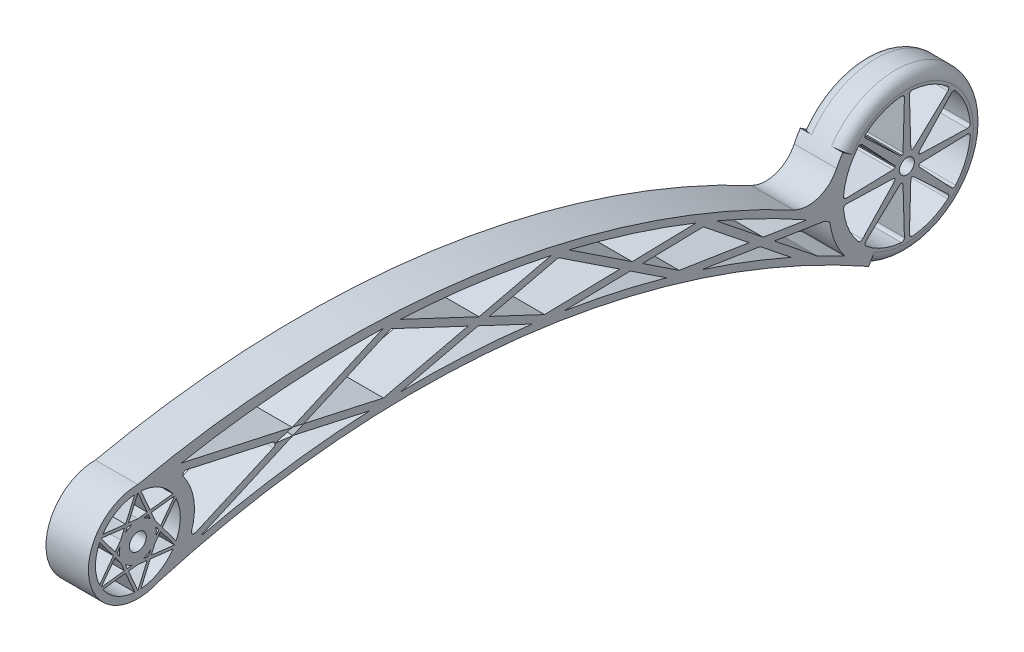
from build123d import *

# Parameters (mm, degrees)
SZKIC1_R                    = 3.0000000000000013
DODANIE_WYCI_GNI_CIE1_DEPTH = 15
WYTNIJ_WYCI_GNI_CIE1_DEPTH  = 303.97760354165104
WYCI_CIE_OBR_T1_ANGLE       = 265.00000000000114
SZKIC4_R                    = 2.6413389418962936
WYTNIJ_WYCI_GNI_CIE2_DEPTH  = 303.97760364050646
ZAOKR_GLENIE2_R             = 1
ZAOKR_GLENIE3_R             = 1


with BuildPart() as part:
    # Szkic1 → Dodanie-wyciągnięcie1 (new body)
    with BuildSketch(Plane(origin=(0, 0, 0), x_dir=(0, 0, -1), z_dir=(1, 0, 0))):
        with BuildLine():
            ThreePointArc((247.14386905317215, 8.669867048888815), (240.61406501931535, 2.878072518954692), (231.9153380807969, 3.595968226311193))
            ThreePointArc((231.91533808079674, 3.595968226310845), (118.77075205195764, 40.0073705160612), (-1.1369e-13, 35.42522894734333))
            ThreePointArc((-4.263e-14, 35.42522894734323), (-17.11785435479439, 14.288051155696689), (7.115506251416886, 1.9371217802628404))
            ThreePointArc((7.115506251417315, 1.9371217802620322), (135.74126507971314, 12.768875604402524), (258.5290498333885, -27.044095150701935))
            ThreePointArc((258.5290498333885, -27.04409515070196), (298.2105787910556, 5.277608418992131), (247.14386905317215, 8.66986704888883))
        make_face()
        with BuildLine():
            Line((86.71196287585684, 39.85172014852097), (54.59601640433131, 25.63196779323211))
            Line((54.59601640433131, 25.63196779323211), (15.371259061907589, 34.30375562276811))
            ThreePointArc((15.371259061907566, 34.303755622767994), (50.88983633712013, 39.02939222675377), (86.71196287585684, 39.85172014852026))
        make_face(mode=Mode.SUBTRACT)
        with BuildLine():
            Line((120.66797341458721, 26.474058591359295), (92.81176762409336, 39.601392917780196))
            ThreePointArc((92.81176762409333, 39.601392917779435), (119.64227628793515, 37.141826382467116), (146.18032427133483, 32.48804599090431))
            Line((146.18032427133505, 32.488045990905256), (120.66797341458721, 26.474058591359295))
        make_face(mode=Mode.SUBTRACT)
        with BuildLine():
            Line((174.84991399733929, 16.273435518201048), (152.4856105962059, 31.04790711767739))
            ThreePointArc((152.48561059620565, 31.047907117676345), (175.25117753037594, 24.736599669939665), (197.5033063836007, 16.802722872715833))
            Line((197.5033063836011, 16.80272287271687), (174.84991399733929, 16.27343551820105))
        make_face(mode=Mode.SUBTRACT)
        with BuildLine():
            Line((221.16225750591792, 0.6095847652137945), (204.59999742397423, 13.883762677302833))
            ThreePointArc((204.59999742397383, 13.883762677301888), (220.82030475857567, 6.4620426304150556), (236.61307264849492, -1.8306517965149283))
            Line((236.61307264849543, -1.8306517965140139), (221.16225750591792, 0.6095847652137937))
        make_face(mode=Mode.SUBTRACT)
        with BuildLine():
            Line((225.09519841335046, -2.5425549225277746), (242.68994389251247, -5.321394797080412))
            ThreePointArc((242.68994389251213, -5.321394797081041), (243.70994318234705, -5.924383596068367), (244.72775709192354, -6.531053925358094))
            ThreePointArc((244.72775709192354, -6.531053925358092), (246.52918688549187, -13.418645500219824), (250.03832796582145, -19.612997434167806))
            ThreePointArc((250.0383279658215, -19.612997434167767), (245.23804821382785, -17.17093269826796), (240.39847516681735, -14.807693693347915))
            Line((240.39847516681735, -14.807693693347897), (225.09519841335046, -2.5425549225277746))
        make_face(mode=Mode.SUBTRACT)
        with BuildLine():
            Line((21.948305518804606, 8.442680568326235), (54.857709427131326, 23.013746507531437))
            Line((54.857709427131326, 23.013746507531433), (81.99464077533202, 17.014328615868333))
            ThreePointArc((81.99464077533202, 17.01432861586835), (51.77371634755495, 14.113835746266773), (21.948305518804602, 8.442680568326239))
        make_face(mode=Mode.SUBTRACT)
        with BuildLine():
            Line((92.96645720572906, 17.375501728865885), (120.39190957994006, 23.84046161952725))
            Line((120.39190957994006, 23.84046161952725), (139.5065287687862, 14.832630527906328))
            ThreePointArc((139.50652876878618, 14.832630527906247), (116.2815352131982, 16.92843679169067), (92.96645720572909, 17.375501728865856))
        make_face(mode=Mode.SUBTRACT)
        with BuildLine():
            Line((150.7937254579246, 13.21069011139366), (174.1253511988679, 13.755824114037251))
            Line((174.1253511988679, 13.755824114037251), (186.99309654488957, 5.255038967541919))
            ThreePointArc((186.99309654488957, 5.25503896754185), (169.00541672809712, 9.742506904499237), (150.7937254579246, 13.21069011139366))
        make_face(mode=Mode.SUBTRACT)
        with BuildLine():
            Line((199.43547561853376, 1.5100334457813434), (220.11666851402651, -1.7562669130035622))
            Line((220.11666851402651, -1.756266913003562), (231.03905749577325, -10.510249391929378))
            ThreePointArc((231.03905749577322, -10.510249391929449), (215.39163289755328, -4.09424986276332), (199.4354756185338, 1.510033445781346))
        make_face(mode=Mode.SUBTRACT)
        with BuildLine():
            Line((14.20879918361564, 32.00038527896806), (50.73912779284115, 23.924280275258774))
            Line((50.73912779284115, 23.924280275258774), (18.132963053328133, 9.487477415884612))
            ThreePointArc((18.13296305332884, 9.487477415884284), (19.702922404067348, 21.3595918779787), (14.20879918361539, 32.000385278967805))
        make_face(mode=Mode.SUBTRACT)
        Polygon((86.8479757216951, 18.501722324906066), (58.71459803862148, 24.72143402550476), (89.55066806325941, 38.374504463564634), (116.75883122700434, 25.552562489680405), align=None, mode=Mode.SUBTRACT)
        Polygon((178.505925039154, 13.858174450783848), (200.0076292842972, 14.360553077500999), (216.1837276065938, 1.3958727747381339), (191.4594501274222, 5.300720856229939), align=None, mode=Mode.SUBTRACT)
        Polygon((143.8506317788958, 15.549149821934162), (124.30105176752294, 24.761957721206137), (148.74353553806114, 30.523746990843186), (170.46934015705276, 16.17108518145446), align=None, mode=Mode.SUBTRACT)
        with Locations((0, 17.925228947343225)):
            Circle(SZKIC1_R, mode=Mode.SUBTRACT)
    extrude(amount=DODANIE_WYCI_GNI_CIE1_DEPTH)

    # Szkic2 → Wytnij-wyciągnięcie1 (cut, through all)
    with BuildSketch(Plane(origin=(15, 0, 0), x_dir=(0, 0, -1), z_dir=(1, 0, 0))):
        Polygon((-4.749370526585766, 24.47363901774454), (-6.067932211414769, 21.428551243027943), (-8.04577473865806, 18.764099440151195), (-12.990381056766234, 25.425228947343374), align=None)
        with BuildLine():
            Line((-8.6684745877329, 17.92522894734628), (-13.508653760358897, 24.44567935990994))
            ThreePointArc((-13.508653760358897, 24.44567935990994), (-15, 17.925228947345317), (-13.508653760360717, 11.40477853478028))
            Line((-13.508653760360717, 11.40477853478028), (-8.6684745877329, 17.92522894734628))
        make_face()
        with BuildLine():
            Line((-6.355965996783881, 19.362785362535288), (-7.42307488958084, 17.925228947343307))
            Line((-7.42307488958084, 17.925228947343307), (-6.355965996783897, 16.487672532151286))
            ThreePointArc((-6.355965996783898, 16.487672532151286), (-6.516507668923027, 17.92522894734329), (-6.35596599678387, 19.362785362535284))
        make_face()
        with BuildLine():
            Line((-3.711537444790369, 24.353800375914847), (-4.422943373321874, 22.710878758551807))
            ThreePointArc((-4.422943373321875, 22.710878758551807), (-3.258253834461477, 23.568690132586703), (-1.9330226234618175, 24.148435173744325))
            Line((-1.9330226234618204, 24.148435173744335), (-3.711537444790369, 24.353800375914847))
        make_face()
        with BuildLine():
            Line((3.711537444790358, 24.353800375914872), (1.9330226234613614, 24.148435173744467))
            ThreePointArc((1.9330226234613608, 24.148435173744467), (3.2582538344613576, 23.56869013258677), (4.422943373322022, 22.710878758551672))
            Line((4.422943373322023, 22.710878758551672), (3.711537444790358, 24.353800375914872))
        make_face()
        with BuildLine():
            Line((7.4230748895808, 17.925228947343463), (6.355965996783689, 19.36278536253609))
            ThreePointArc((6.355965996783688, 19.36278536253609), (6.476247885951691, 18.648475460531408), (6.516507668923027, 17.925228947343225))
            ThreePointArc((6.516507668923027, 17.925228947343225), (6.476247885951745, 17.201982434155514), (6.355965996783897, 16.487672532151283))
            Line((6.355965996783897, 16.487672532151283), (7.4230748895808, 17.925228947343463))
        make_face()
        with BuildLine():
            ThreePointArc((4.422943373321714, 13.139579136134493), (3.2582538344618652, 12.281767762099971), (1.9330226234628807, 11.702022720942455))
            Line((1.9330226234628818, 11.702022720942455), (3.7115374447905536, 11.496657518772196))
            Line((3.7115374447905536, 11.496657518772196), (4.422943373321715, 13.139579136134497))
        make_face()
        with BuildLine():
            ThreePointArc((-1.9330226234626287, 11.702022720942377), (-3.258253834461411, 12.281767762099712), (-4.422943373321141, 13.139579136133964))
            Line((-4.422943373321139, 13.139579136133964), (-3.71153744479015, 11.49665751877212))
            Line((-3.71153744479015, 11.49665751877212), (-1.9330226234626273, 11.702022720942377))
        make_face()
        Polygon((-12.990381056766198, 10.425228947343442), (-4.749370526581913, 11.376818876942833), (-6.0679322114113035, 14.421906651660326), (-8.045774738655652, 17.08635845453843), align=None)
        Polygon((3.296404212072303, 25.31250951055219), (-1.50201e-11, 24.931873538710896), (-3.296404212073718, 25.312509510548917), (0, 32.92522894734322), align=None)
        with BuildLine():
            ThreePointArc((12.401202581576591, 26.36384106846232), (7.499999999999998, 30.915610004109805), (1.1074511787841261, 32.88429148102526))
            Line((1.107451178784127, 32.88429148102526), (4.334237293867699, 25.432348152381884))
            Line((4.3342372938677, 25.432348152381884), (12.40120258157659, 26.36384106846232))
        make_face()
        with BuildLine():
            ThreePointArc((-1.1074511787841275, 32.88429148102526), (-7.500000000001618, 30.91561000410887), (-12.401202581578698, 26.363841068459223))
            Line((-12.401202581578696, 26.363841068459223), (-4.334237293869107, 25.432348152378626))
            Line((-4.334237293869108, 25.432348152378626), (-1.107451178784128, 32.884291481025265))
        make_face()
        Polygon((12.990381056766461, 25.425228947343413), (4.749370526585762, 24.47363901774456), (6.067932211414603, 21.42855124302833), (8.04577473865805, 18.764099440151334), align=None)
        with BuildLine():
            ThreePointArc((15, 17.925228947343225), (14.622410991444106, 21.269641720506044), (13.508653760360719, 24.445679359906165))
            Line((13.508653760360717, 24.445679359906165), (8.668474587735332, 17.925228947343403))
            Line((8.668474587735332, 17.925228947343403), (13.508653760360719, 11.40477853478029))
            ThreePointArc((13.508653760360719, 11.404778534780288), (14.622410991444108, 14.580816174180413), (15, 17.92522894734322))
        make_face()
        Polygon((4.749370526585941, 11.3768188769425), (6.067932211414883, 14.421906651659038), (8.045774738658086, 17.08635845453556), (12.990381056766541, 10.425228947343602), align=None)
        with BuildLine():
            Line((-4.3342372938637315, 10.418109742305223), (-12.401202581576582, 9.48661682622412))
            ThreePointArc((-12.401202581576586, 9.486616826224122), (-7.49999999999809, 4.9348478905755435), (-1.1074511787797334, 2.966166413660863))
            Line((-1.107451178779732, 2.966166413660864), (-4.334237293863731, 10.418109742305223))
        make_face()
        Polygon((2.5337e-13, 2.9252289473436637), (3.2964042120724173, 10.537948384134655), (3.8684e-13, 10.918584355974176), (-3.296404212071974, 10.537948384134525), align=None)
        with BuildLine():
            Line((4.334237293867797, 10.418109742304964), (1.1074511787841348, 2.966166413661188))
            ThreePointArc((1.107451178784139, 2.96616641366119), (7.500000000000208, 4.934847890576766), (12.401202581576863, 9.48661682622453))
            Line((12.401202581576863, 9.486616826224532), (4.334237293867796, 10.418109742304964))
        make_face()
    extrude(amount=-WYTNIJ_WYCI_GNI_CIE1_DEPTH, mode=Mode.SUBTRACT)

    # Szkic3 → Wycięcie-obrót1 (revolve, cut)
    with BuildSketch(Plane(origin=(0, -116.95960868066354, -207.9590871503928), x_dir=(1, 0, 0), z_dir=(0, 0.49020591019126136, 0.8716066576234701))):
        with BuildLine():
            ThreePointArc((14.999999999999996, 107.16065480170373), (13.82842712474619, 104.33222767695754), (11.000000000000004, 103.16065480170373))
            Line((11.000000000000004, 103.16065480170374), (15, 103.16065480170374))
            Line((15, 103.16065480170374), (15, 107.16065480170373))
        make_face()
        with BuildLine():
            Line((0, 103.16065480170374), (3.9999999999999973, 103.16065480170374))
            ThreePointArc((3.9999999999999973, 103.16065480170373), (1.1715728752538102, 104.33222767695754), (1.78e-15, 107.16065480170373))
            Line((0, 107.16065480170373), (0, 103.16065480170374))
        make_face()
    revolve(axis=Axis((15, -3.0749120660565206, -272.0097123636482), (1, 0, 0)), revolution_arc=WYCI_CIE_OBR_T1_ANGLE, mode=Mode.SUBTRACT)

    # Szkic4 → Wytnij-wyciągnięcie2 (cut, through all)
    with BuildSketch(Plane.ZY):
        with BuildLine():
            Line((-276.28696164373895, -4.473174772404359), (-294.49354358999744, -3.9277504945065007))
            ThreePointArc((-294.49354358999744, -3.9277504945064985), (-292.7970018451521, -11.68528929427105), (-288.51122972686704, -18.3703337572485))
            Line((-288.51122972686704, -18.370333757248503), (-276.02290537596446, -5.1106629952951685))
            ThreePointArc((-276.02290537596446, -5.1106629952951685), (-276.167170259949, -4.796987511699434), (-276.28696164373895, -4.473174772404361))
        make_face()
        with BuildLine():
            ThreePointArc((-288.51122972686704, 12.220509625135447), (-292.7970018451521, 5.535465162158003), (-294.49354358999744, -2.222073637606548))
            Line((-294.49354358999744, -2.222073637606547), (-276.28696164373895, -1.6766493597086827))
            ThreePointArc((-276.28696164373895, -1.6766493597086796), (-276.167170259949, -1.3528366204136075), (-276.02290537596446, -1.0391611368178704))
            Line((-276.02290537596446, -1.0391611368178726), (-288.51122972686704, 12.220509625135435))
        make_face()
        with BuildLine():
            Line((-274.04546329288684, -7.0881050783727915), (-287.30513405484015, -19.5764294292754))
            ThreePointArc((-287.30513405484015, -19.57642942927539), (-280.6200895918627, -23.86220154756045), (-272.8625507920982, -25.55874329240578))
            Line((-272.8625507920982, -25.558743292405815), (-273.40797506999604, -7.352161346147302))
            ThreePointArc((-273.40797506999604, -7.352161346147286), (-273.7317878092911, -7.232369962357328), (-274.04546329288684, -7.088105078372793))
        make_face()
        with BuildLine():
            ThreePointArc((-272.86255079209815, 19.408919160292744), (-280.62008959186267, 17.71237741544742), (-287.30513405484015, 13.426605297162352))
            Line((-287.30513405484015, 13.426605297162359), (-274.04546329288684, 0.9382809462597503))
            ThreePointArc((-274.04546329288684, 0.9382809462597517), (-273.73178780929106, 1.0825458302442947), (-273.407975069996, 1.2023372140342583))
            Line((-273.407975069996, 1.2023372140342339), (-272.86255079209815, 19.408919160292747))
        make_face()
        with BuildLine():
            Line((-270.6114496573004, -7.352161346147302), (-271.15687393519823, -25.558743292405815))
            ThreePointArc((-271.15687393519823, -25.558743292405783), (-263.3993351354337, -23.86220154756046), (-256.71429067245623, -19.576429429275397))
            Line((-256.71429067245623, -19.5764294292754), (-269.97396143440955, -7.0881050783727915))
            ThreePointArc((-269.97396143440955, -7.088105078372795), (-270.2876369180053, -7.232369962357339), (-270.6114496573004, -7.352161346147303))
        make_face()
        with BuildLine():
            ThreePointArc((-256.71429067245623, 13.426605297162352), (-263.39933513543366, 17.71237741544741), (-271.1568739351982, 19.40891916029274))
            Line((-271.1568739351982, 19.408919160292747), (-270.6114496573003, 1.2023372140342339))
            ThreePointArc((-270.6114496573003, 1.2023372140342246), (-270.2876369180052, 1.0825458302442645), (-269.9739614344095, 0.9382809462597286))
            Line((-269.9739614344095, 0.9382809462597503), (-256.71429067245623, 13.426605297162359))
        make_face()
        with BuildLine():
            Line((-267.99651935133187, -5.1106629952951685), (-255.5081950004293, -18.370333757248503))
            ThreePointArc((-255.50819500042934, -18.370333757248492), (-251.22242288214426, -11.68528929427105), (-249.52588113729894, -3.927750494506487))
            Line((-249.5258811372989, -3.927750494506492), (-267.7324630835575, -4.473174772404358))
            ThreePointArc((-267.73246308355743, -4.473174772404381), (-267.8522544673474, -4.796987511699431), (-267.9965193513319, -5.110662995295149))
        make_face()
        with BuildLine():
            ThreePointArc((-249.52588113729894, -2.222073637606534), (-251.22242288214426, 5.535465162158001), (-255.50819500042934, 12.220509625135442))
            Line((-255.5081950004293, 12.220509625135461), (-267.9965193513318, -1.0391611368178726))
            ThreePointArc((-267.9965193513319, -1.039161136817916), (-267.8522544673474, -1.3528366204136228), (-267.73246308355743, -1.6766493597086622))
            Line((-267.7324630835575, -1.6766493597086818), (-249.52588113729902, -2.2220736376065378))
        make_face()
        with Locations((-272.0097123636482, -3.074912066056521)):
            Circle(SZKIC4_R)
    extrude(amount=-WYTNIJ_WYCI_GNI_CIE2_DEPTH, mode=Mode.SUBTRACT)

    # Zaokrąglenie2
    # the kernel refuses this fillet: 1 mm, written as the material it adds along each edge
    with BuildSketch(Plane(origin=(0, -1.0391611368178943, -267.99651935133187), x_dir=(0, 0.7279633723747813, 0.6856160211669035), z_dir=(1, 0, 0))) as zaokr_glenie2_piece_1:
        with BuildLine():
            CenterArc((0.6523105054833352, 1.0000000000000013), ZAOKR_GLENIE2_R, 207.33683466870096, 62.663165331297364)
            ThreePointArc((-0.2360116840668876, 0.5407792605372268), (-0.10913296990104362, 0.27426200786756466), (0, 0))
            Line((0, 0), (0.652310505483306, 2e-17))
        make_face()
    extrude(amount=15)
    with BuildSketch(Plane(origin=(0, -1.6766493597086718, -267.7324630835575), x_dir=(0, -0.0299440992044147, 0.9995515749188914), z_dir=(1, 0, 0))) as zaokr_glenie2_piece_2:
        with BuildLine():
            CenterArc((0.6523105054834588, -0.9999999999999998), ZAOKR_GLENIE2_R, 89.99999999999834, 62.663165331299226)
            ThreePointArc((-0.23601168406674122, -0.5407792605372082), (-0.10913296990095891, -0.27426200786755334), (0, 0))
            Line((0, 0), (0.652310505483488, 0))
        make_face()
    extrude(amount=15)
    with BuildSketch(Plane(origin=(0, 12.22050962513545, -255.50819500042934), x_dir=(0, -0.7279633723747962, -0.6856160211668874), z_dir=(1, 0, 0))) as zaokr_glenie2_piece_3:
        with BuildLine():
            CenterArc((1.0970810552204335, -1.000000000000001), ZAOKR_GLENIE2_R, 89.99999999999959, 96.74640415342816)
            ThreePointArc((0.10400522364914143, -1.117475072883543), (0.04503404236574343, -0.5593861125421823), (0, 0))
            Line((0, 0), (1.0970810552204406, -2e-17))
        make_face()
    extrude(amount=15)
    with BuildSketch(Plane(origin=(0, -2.222073637606536, -249.525881137299), x_dir=(0, 0.9980252307388967, -0.0628143200916175), z_dir=(1, 0, 0))) as zaokr_glenie2_piece_4:
        with BuildLine():
            CenterArc((1.0973645020845546, -0.999688947271241), ZAOKR_GLENIE2_R, 88.57088921708781, 96.74640415350945)
            Line((0.10166772912290006, -1.0923600663631525), (0, 0))
            ThreePointArc((0, 0), (0.5611523022023575, 0.00699868639733426), (1.1223046044047162, 0))
        make_face()
    extrude(amount=15)
    with BuildSketch(Plane(origin=(0, -7.0881050783727915, -269.97396143440955), x_dir=(0, -0.3929483772979695, -0.9195605324169217), z_dir=(1, 0, 0))) as zaokr_glenie2_piece_5:
        with BuildLine():
            CenterArc((0.6555967253016459, -0.9978486505165693), ZAOKR_GLENIE2_R, 93.75898856175243, 62.66316533129816)
            Line((-0.26092073406317673, -0.597853967202595), (0, 0))
            ThreePointArc((0, 0), (0.29501852638574716, -0.00968107267543209), (0.5900370527714927, -2e-17))
        make_face()
    extrude(amount=15)
    with BuildSketch(Plane(origin=(0, -7.352161346147303, -270.6114496573004), x_dir=(0, -0.9995515749188927, -0.029944099204370734), z_dir=(1, 0, 0))) as zaokr_glenie2_piece_6:
        with BuildLine():
            CenterArc((0.6523105054833831, -0.9999999999999907), ZAOKR_GLENIE2_R, 90.00000000000158, 62.66316533129891)
            ThreePointArc((-0.2360116840668347, -0.5407792605372477), (-0.10913296990101062, -0.2742620078676106), (0, 0))
            Line((0, 0), (0.6523105054833557, 0))
        make_face()
    extrude(amount=15)
    with BuildSketch(Plane(origin=(0, -19.576429429275393, -256.71429067245623), x_dir=(0, 0.6856160211668924, -0.7279633723747916), z_dir=(1, 0, 0))) as zaokr_glenie2_piece_7:
        with BuildLine():
            CenterArc((1.0970810552251236, -0.9999999999999961), ZAOKR_GLENIE2_R, 89.99999999999919, 96.74640415342623)
            ThreePointArc((0.10400522365383967, -1.1174750728834957), (0.04503404236578149, -0.5593861125424465), (0, 0))
            Line((0, 0), (1.0970810552251378, 0))
        make_face()
    extrude(amount=15)
    with BuildSketch(Plane(origin=(0, -4.473174772404369, -267.7324630835575), x_dir=(0, 0.029944099204419008, 0.9995515749188914), z_dir=(1, 0, 0))) as zaokr_glenie2_piece_8:
        with BuildLine():
            CenterArc((0.6523105054833979, 1.0000000000000002), ZAOKR_GLENIE2_R, 207.33683466870332, 62.663165331298615)
            ThreePointArc((-0.2360116840668, 0.5407792605371928), (-0.10913296990096008, 0.2742620078675522), (0, 0))
            Line((0, 0), (0.6523105054834313, 0))
        make_face()
    extrude(amount=15)
    with BuildSketch(Plane(origin=(0, -7.0881050783727915, -274.04546329288684), x_dir=(0, -0.6856160211668986, -0.7279633723747856), z_dir=(1, 0, 0))) as zaokr_glenie2_piece_9:
        with BuildLine():
            CenterArc((0.652310505483376, -0.9999999999999973), ZAOKR_GLENIE2_R, 90.00000000000139, 62.66316533129475)
            ThreePointArc((-0.2360116840668056, -0.5407792605371874), (-0.10913296990095936, -0.27426200786753413), (0, 0))
            Line((0, 0), (0.6523105054833519, 2e-17))
        make_face()
    extrude(amount=15)
    with BuildSketch(Plane(origin=(0, -7.352161346147294, -273.40797506999604), x_dir=(0, -0.9995515749188927, 0.02994409920437053), z_dir=(1, 0, 0))) as zaokr_glenie2_piece_10:
        with BuildLine():
            CenterArc((0.6523105054833878, 0.9999999999999907), ZAOKR_GLENIE2_R, 207.3368346687031, 62.66316533129532)
            ThreePointArc((-0.23601168406680184, 0.5407792605371918), (-0.10913296990098312, 0.2742620078675546), (0, 0))
            Line((0, 0), (0.65231050548336, 0))
        make_face()
    extrude(amount=15)
    with BuildSketch(Plane(origin=(0, -3.9277504945064896, -249.52588113729894), x_dir=(0, -0.02994409920440287, -0.9995515749188917), z_dir=(1, 0, 0))) as zaokr_glenie2_piece_11:
        with BuildLine():
            CenterArc((1.097081055223315, -1), ZAOKR_GLENIE2_R, 89.99999999999936, 96.74640415355515)
            ThreePointArc((0.10400522365228276, -1.1174750728857392), (0.04503404236584158, -0.5593861125434373), (0, 0))
            Line((0, 0), (1.097081055223326, 0))
        make_face()
    extrude(amount=15)
    with BuildSketch(Plane(origin=(0, -18.370333757248495, -255.50819500042934), x_dir=(0, 0.7501268401431951, 0.6612939767582837), z_dir=(1, 0, 0))) as zaokr_glenie2_piece_12:
        with BuildLine():
            CenterArc((1.0973645020849179, -0.999688947271231), ZAOKR_GLENIE2_R, 88.5708892170913, 96.74640415351087)
            Line((0.10166772912327839, -1.0923600663632267), (0, 0))
            ThreePointArc((0, 0), (0.5611523022025391, 0.00699868639729401), (1.1223046044050182, 0))
        make_face()
    extrude(amount=15)
    with BuildSketch(Plane(origin=(0, 19.40891916029274, -272.86255079209815), x_dir=(0, -0.0628143200916797, -0.9980252307388927), z_dir=(1, 0, 0))) as zaokr_glenie2_piece_13:
        with BuildLine():
            CenterArc((1.0973645020844052, -0.9996889472712321), ZAOKR_GLENIE2_R, 88.57088921709108, 96.74640415349302)
            Line((0.10166772912271652, -1.0923600663629165), (0, 0))
            ThreePointArc((0, 0), (0.5611523022022534, 0.00699868639729153), (1.1223046044045095, -1e-17))
        make_face()
    extrude(amount=15)
    with BuildSketch(Plane(origin=(0, -1.0391611368178713, -276.02290537596446), x_dir=(0, 0.7279633723748022, -0.6856160211668811), z_dir=(1, 0, 0))) as zaokr_glenie2_piece_14:
        with BuildLine():
            CenterArc((0.6523105054834076, -1.0000000000000024), ZAOKR_GLENIE2_R, 89.99999999999986, 62.66316533129617)
            ThreePointArc((-0.2360116840667847, -0.5407792605371852), (-0.10913296990100531, -0.2742620078675173), (0, 0))
            Line((0, 0), (0.6523105054834102, 0))
        make_face()
    extrude(amount=15)
    with BuildSketch(Plane(origin=(0, -4.47317477240436, -276.28696164373895), x_dir=(0, 0.029944099204399964, -0.9995515749188919), z_dir=(1, 0, 0))) as zaokr_glenie2_piece_15:
        with BuildLine():
            CenterArc((0.6523105054834165, -1.0000000000000002), ZAOKR_GLENIE2_R, 89.99999999999919, 62.663165331300476)
            ThreePointArc((-0.23601168406679118, -0.5407792605372461), (-0.10913296990101273, -0.2742620078675881), (0, 0))
            Line((0, 0), (0.6523105054834308, 0))
        make_face()
    extrude(amount=15)
    with BuildSketch(Plane(origin=(0, 12.220509625135442, -288.51122972686704), x_dir=(0, -0.7279633723747974, 0.685616021166886), z_dir=(1, 0, 0))) as zaokr_glenie2_piece_16:
        with BuildLine():
            CenterArc((1.097081055222594, 1.0000000000000022), ZAOKR_GLENIE2_R, 173.2535958464652, 96.74640415353502)
            ThreePointArc((0.10400522365152876, 1.1174750728853988), (0.04503404236581977, 0.5593861125432292), (0, 0))
            Line((0, 0), (1.0970810552225982, 1.1e-16))
        make_face()
    extrude(amount=15)
    with BuildSketch(Plane(origin=(0, -18.370333757248495, -288.51122972686704), x_dir=(0, 0.7501268401431492, -0.6612939767583358), z_dir=(1, 0, 0))) as zaokr_glenie2_piece_17:
        with BuildLine():
            CenterArc((1.0973645020820684, 0.999688947271243), ZAOKR_GLENIE2_R, 174.68270662956036, 96.74640415334648)
            Line((0.10166772912017569, 1.0923600663604138), (0, 0))
            ThreePointArc((0, 0), (0.5611523022011092, -0.0069986863972657), (1.1223046044021363, -4e-17))
        make_face()
    extrude(amount=15)
    with BuildSketch(Plane(origin=(0, -25.558743292405808, -272.8625507920982), x_dir=(0, 0.9995515749188911, -0.029944099204423556), z_dir=(1, 0, 0))) as zaokr_glenie2_piece_18:
        with BuildLine():
            CenterArc((1.0970810552235708, -0.9999999999999907), ZAOKR_GLENIE2_R, 90.00000000000135, 96.74640415371641)
            ThreePointArc((0.10400522365287737, -1.117475072888559), (0.0450340423660103, -0.5593861125448855), (0, 0))
            Line((0, 0), (1.0970810552235473, 0))
        make_face()
    extrude(amount=15)
    with BuildSketch(Plane(origin=(0, -5.1106629952951685, -276.02290537596446), x_dir=(0, 0.919560532416912, -0.3929483772979924), z_dir=(1, 0, 0))) as zaokr_glenie2_piece_19:
        with BuildLine():
            CenterArc((0.6555967253016699, -0.9978486505165827), ZAOKR_GLENIE2_R, 93.75898856175532, 62.66316533129684)
            Line((-0.26092073406316724, -0.5978539672026318), (0, 0))
            ThreePointArc((0, 0), (0.2950185263857061, -0.00968107267540476), (0.5900370527714652, 0))
        make_face()
    extrude(amount=15)
    with BuildSketch(Plane(origin=(0, -1.6766493597086811, -276.28696164373895), x_dir=(0, 0.9280839504271531, 0.3723710259398945), z_dir=(1, 0, 0))) as zaokr_glenie2_piece_20:
        with BuildLine():
            CenterArc((0.655596725301614, -0.9978486505165761), ZAOKR_GLENIE2_R, 93.75898856175117, 62.66316533129951)
            Line((-0.26092073406321087, -0.5978539672026022), (0, 0))
            ThreePointArc((0, 0), (0.29501852638574616, -0.00968107267543258), (0.5900370527714822, -1e-17))
        make_face()
    extrude(amount=15)
    with BuildSketch(Plane(origin=(0, 0.9382809462597499, -274.04546329288684), x_dir=(0, 0.3929483772979587, 0.9195605324169264), z_dir=(1, 0, 0))) as zaokr_glenie2_piece_21:
        with BuildLine():
            CenterArc((0.6555967253016313, -0.9978486505165703), ZAOKR_GLENIE2_R, 93.75898856175176, 62.6631653312982)
            Line((-0.2609207340631863, -0.5978539672025861), (0, 0))
            ThreePointArc((0, 0), (0.2950185263856894, -0.00968107267544525), (0.5900370527714898, -1e-17))
        make_face()
    extrude(amount=15)
    with BuildSketch(Plane(origin=(0, 1.2023372140342476, -273.407975069996), x_dir=(0, -0.37237102593985144, -0.9280839504271703), z_dir=(1, 0, 0))) as zaokr_glenie2_piece_22:
        with BuildLine():
            CenterArc((0.6555967253016637, 0.997848650516569), ZAOKR_GLENIE2_R, 203.57784610694745, 62.66316533129884)
            Line((-0.26092073406316585, 0.597853967202629), (0, 0))
            ThreePointArc((0, 0), (0.29501852638578246, 0.00968107267544045), (0.5900370527714887, 1e-17))
        make_face()
    extrude(amount=15)
    with BuildSketch(Plane(origin=(0, -25.5587432924058, -271.15687393519823), x_dir=(0, 0.9995515749188923, 0.029944099204384587), z_dir=(1, 0, 0))) as zaokr_glenie2_piece_23:
        with BuildLine():
            CenterArc((1.0970810552230614, 0.9999999999999908), ZAOKR_GLENIE2_R, 173.2535958464512, 96.74640415354969)
            ThreePointArc((0.10400522365202086, 1.1174750728856304), (0.04503404236585731, 0.5593861125433557), (0, 0))
            Line((0, 0), (1.097081055223077, 0))
        make_face()
    extrude(amount=15)
    with BuildSketch(Plane(origin=(0, -19.576429429275393, -287.30513405484015), x_dir=(0, -0.6612939767582722, 0.7501268401432053), z_dir=(1, 0, 0))) as zaokr_glenie2_piece_24:
        with BuildLine():
            CenterArc((1.0973645020850624, -0.9996889472712236), ZAOKR_GLENIE2_R, 88.57088921709014, 96.74640415347397)
            Line((0.10166772912333646, -1.0923600663625608), (0, 0))
            ThreePointArc((0, 0), (0.5611523022025832, 0.0069986863973205), (1.122304604405183, -8e-17))
        make_face()
    extrude(amount=15)
    with BuildSketch(Plane(origin=(0, 13.426605297162357, -287.30513405484015), x_dir=(0, -0.6856160211668926, 0.7279633723747914), z_dir=(1, 0, 0))) as zaokr_glenie2_piece_25:
        with BuildLine():
            CenterArc((1.0970810552249661, -0.9999999999999974), ZAOKR_GLENIE2_R, 89.99999999999909, 96.74640415341389)
            ThreePointArc((0.10400522365364945, -1.1174750728832827), (0.04503404236576309, -0.5593861125423), (0, 0))
            Line((0, 0), (1.097081055224982, 6e-17))
        make_face()
    extrude(amount=15)
    with BuildSketch(Plane(origin=(0, -2.2220736376065475, -294.49354358999744), x_dir=(0, 0.029944099204400044, 0.9995515749188918), z_dir=(1, 0, 0))) as zaokr_glenie2_piece_26:
        with BuildLine():
            CenterArc((1.0970810552192176, -1), ZAOKR_GLENIE2_R, 90.00000000000082, 96.74640415357771)
            ThreePointArc((0.10400522364822598, -1.1174750728861569), (0.04503404236586946, -0.5593861125434717), (0, 0))
            Line((0, 0), (1.0970810552192032, 0))
        make_face()
    extrude(amount=15)
    with BuildSketch(Plane(origin=(0, -3.9277504945064994, -294.49354358999744), x_dir=(0, -0.9980252307388935, 0.0628143200916681), z_dir=(1, 0, 0))) as zaokr_glenie2_piece_27:
        with BuildLine():
            CenterArc((1.0973645020846017, -0.999688947271214), ZAOKR_GLENIE2_R, 88.57088921709041, 96.74640415347722)
            Line((0.10166772912289936, -1.0923600663626098), (0, 0))
            ThreePointArc((0, 0), (0.5611523022023599, 0.00699868639727746), (1.1223046044047171, 0))
        make_face()
    extrude(amount=15)
    with BuildSketch(Plane(origin=(0, -5.110662995295159, -267.9965193513319), x_dir=(0, -0.7279633723747678, 0.6856160211669177), z_dir=(1, 0, 0))) as zaokr_glenie2_piece_28:
        with BuildLine():
            CenterArc((0.6523105054834235, -1.0000000000000018), ZAOKR_GLENIE2_R, 90.00000000000276, 62.66316533129742)
            ThreePointArc((-0.2360116840668088, -0.5407792605372452), (-0.10913296990096921, -0.27426200786757987), (0, 0))
            Line((0, 0), (0.6523105054833754, 2e-17))
        make_face()
    extrude(amount=15)
    with BuildSketch(Plane(origin=(0, 1.2023372140342308, -270.6114496573003), x_dir=(0, -0.3723710259398735, 0.9280839504271615), z_dir=(1, 0, 0))) as zaokr_glenie2_piece_29:
        with BuildLine():
            CenterArc((0.6555967253015856, -0.9978486505165678), ZAOKR_GLENIE2_R, 93.75898856175588, 62.663165331295104)
            Line((-0.26092073406323313, -0.5978539672026025), (0, 0))
            ThreePointArc((0, 0), (0.2950185263857252, -0.009681072675437), (0.5900370527713719, 1e-17))
        make_face()
    extrude(amount=15)
    with BuildSketch(Plane(origin=(0, 0.9382809462597388, -269.9739614344095), x_dir=(0, 0.3929483772979667, -0.919560532416923), z_dir=(1, 0, 0))) as zaokr_glenie2_piece_30:
        with BuildLine():
            CenterArc((0.6555967253016427, 0.9978486505165707), ZAOKR_GLENIE2_R, 203.57784610694952, 62.66316533129822)
            Line((-0.26092073406317845, 0.5978539672025945), (0, 0))
            ThreePointArc((0, 0), (0.29501852638574405, 0.00968107267542566), (0.590037052771492, -3e-17))
        make_face()
    extrude(amount=15)
    with BuildSketch(Plane(origin=(0, 19.408919160292754, -271.1568739351982), x_dir=(0, -0.9995515749188921, 0.029944099204391464), z_dir=(1, 0, 0))) as zaokr_glenie2_piece_31:
        with BuildLine():
            CenterArc((1.0970810552228125, -0.9999999999999909), ZAOKR_GLENIE2_R, 89.9999999999993, 96.74640415323273)
            ThreePointArc((0.10400522365112481, -1.1174750728801404), (0.0450340423655877, -0.5593861125406339), (0, 0))
            Line((0, 0), (1.0970810552228247, 0))
        make_face()
    extrude(amount=15)
    with BuildSketch(Plane(origin=(0, 13.42660529716235, -256.71429067245623), x_dir=(0, 0.6612939767582956, -0.7501268401431846), z_dir=(1, 0, 0))) as zaokr_glenie2_piece_32:
        with BuildLine():
            CenterArc((1.0973645020842948, -0.9996889472712337), ZAOKR_GLENIE2_R, 88.57088921709214, 96.74640415351041)
            Line((0.1016677291226324, -1.0923600663632378), (0, 0))
            ThreePointArc((0, 0), (0.561152302202194, 0.00699868639729109), (1.1223046044043805, 0))
        make_face()
    extrude(amount=15)

    # Zaokrąglenie3
    zaokr_glenie3_edges = [part.edges().sort_by_distance(p)[0] for p in [
        (7.5, 23.924280275258774, -50.73912779284115),
        (7.5, 32.00038527896793, -14.208799183615517),
        (7.5, 9.487477415884449, -18.13296305332849),
    ]]
    fillet(zaokr_glenie3_edges, radius=ZAOKR_GLENIE3_R)


solid = part.part
